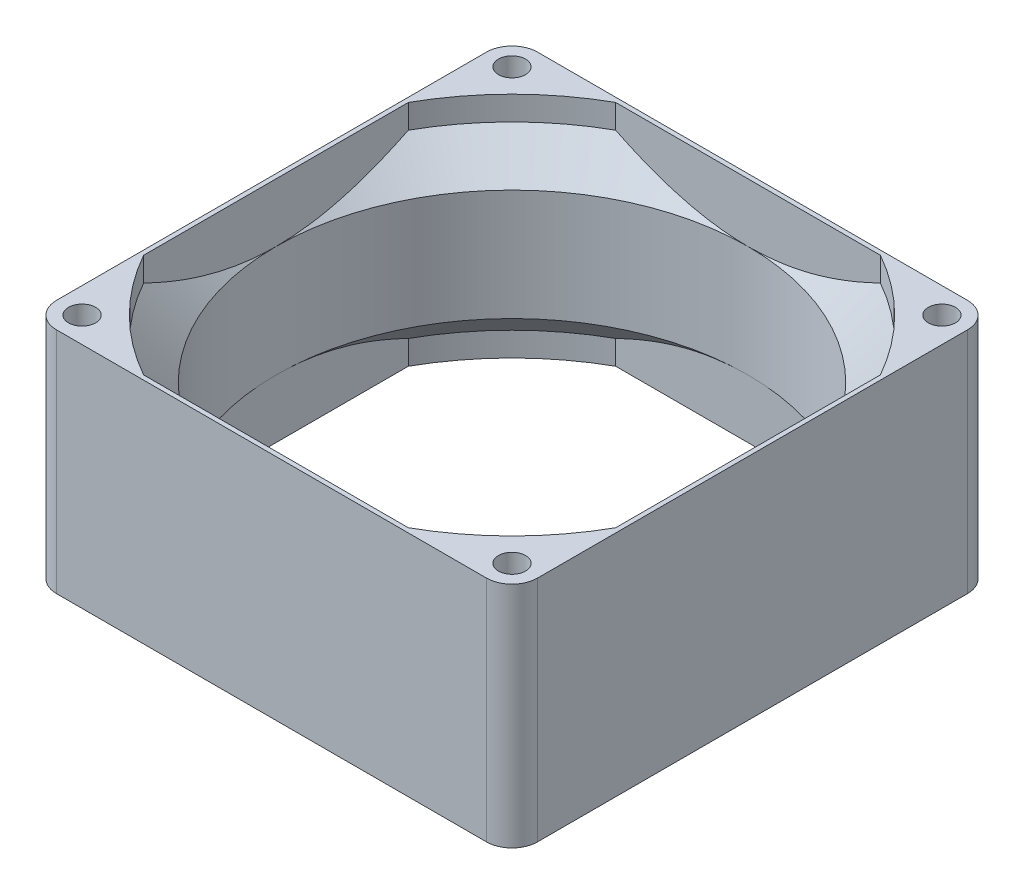
from build123d import *

# Parameters (mm, degrees)
SKETCH1_R               = 2.25
BOSS_EXTRUDE1_DEPTH     = 38
CUT_EXTRUDE1_DEPTH      = 75.121521841
CUT_EXTRUDE1_DEPTH_BACK = 75.121521841


with BuildPart() as part:
    # Sketch1 → Boss-Extrude1 (new body)
    with BuildSketch(Plane(origin=(0, 0, 0), x_dir=(1, 0, 0), z_dir=(0, 1, 0))):
        with BuildLine():
            Line((-35.75, -40), (35.75, -40))
            ThreePointArc((35.75, -40), (38.75520382, -38.75520382), (40, -35.75))
            Line((40, -35.75), (40, 35.75))
            ThreePointArc((40, 35.75), (38.75520382, 38.75520382), (35.75, 40))
            Line((35.75, 40), (-35.75, 40))
            ThreePointArc((-35.75, 40), (-38.75520382, 38.75520382), (-40, 35.75))
            Line((-40, 35.75), (-40, -35.75))
            ThreePointArc((-40, -35.75), (-38.75520382, -38.75520382), (-35.75, -40))
        make_face()
        with Locations((35.75, 35.75)):
            Circle(SKETCH1_R, mode=Mode.SUBTRACT)
        with Locations((35.75, -35.75)):
            Circle(SKETCH1_R, mode=Mode.SUBTRACT)
        with Locations((-35.75, -35.75)):
            Circle(SKETCH1_R, mode=Mode.SUBTRACT)
        with Locations((-35.75, 35.75)):
            Circle(SKETCH1_R, mode=Mode.SUBTRACT)
        with BuildLine():
            Line((22.009940936, 39.25), (-22.009940936, 39.25))
            ThreePointArc((-22.009940936, 39.25), (-31.819805153, 31.819805153), (-39.25, 22.009940936))
            Line((-39.25, 22.009940936), (-39.25, -22.009940936))
            ThreePointArc((-39.25, -22.009940936), (-31.819805153, -31.819805153), (-22.009940936, -39.25))
            Line((-22.009940936, -39.25), (22.009940936, -39.25))
            ThreePointArc((22.009940936, -39.25), (31.819805153, -31.819805153), (39.25, -22.009940936))
            Line((39.25, -22.009940936), (39.25, 22.009940936))
            ThreePointArc((39.25, 22.009940936), (31.819805153, 31.819805153), (22.009940936, 39.25))
        make_face(mode=Mode.SUBTRACT)
    extrude(amount=BOSS_EXTRUDE1_DEPTH)

    # Sketch2 → Revolve1 (revolve)
    with BuildSketch(Plane(origin=(0, 0, 0), x_dir=(0, 0, -1), z_dir=(1, 0, 0))):
        Polygon((45, 34), (39.25, 28.25), (39.25, 9.75), (45, 4), align=None)
    revolve(axis=Axis((0, 0, 0), (0, 1, 0)))

    # Sketch3 → Cut-Extrude1 (cut, two sides: drawn at the far end of the back side and taken through both)
    with BuildSketch(Plane(origin=(0, 0, 0), x_dir=(1, 0, 0), z_dir=(0, 1, 0)).offset(-CUT_EXTRUDE1_DEPTH_BACK)):
        with BuildLine():
            Line((-40, -35.75), (-40, 35.75))
            ThreePointArc((-40, 35.75), (-39.676488013, 37.376404588), (-38.75520382, 38.75520382))
            ThreePointArc((-38.75520382, 38.75520382), (-54.808134855, 0), (-38.75520382, -38.75520382))
            ThreePointArc((-38.75520382, -38.75520382), (-39.676488013, -37.376404588), (-40, -35.75))
        make_face()
        with BuildLine():
            ThreePointArc((38.755203786, 38.755203854), (-2.4e-08, 54.808134855), (-38.75520382, 38.75520382))
            ThreePointArc((-38.75520382, 38.75520382), (-37.376404588, 39.676488013), (-35.75, 40))
            Line((-35.75, 40), (35.75, 40))
            ThreePointArc((35.75, 40), (37.376404566, 39.676488022), (38.755203786, 38.755203854))
        make_face()
        with BuildLine():
            ThreePointArc((-35.75, -40), (-37.376404588, -39.676488013), (-38.75520382, -38.75520382))
            ThreePointArc((-38.75520382, -38.75520382), (6e-09, -54.808134855), (38.755203828, -38.755203812))
            ThreePointArc((38.755203828, -38.755203812), (37.376404593, -39.676488011), (35.75, -40))
            Line((35.75, -40), (-35.75, -40))
        make_face()
        with BuildLine():
            ThreePointArc((38.755203828, -38.755203812), (54.808134855, 2.9e-08), (38.755203786, 38.755203854))
            ThreePointArc((38.755203786, 38.755203854), (39.676488004, 37.376404609), (40, 35.75))
            Line((40, 35.75), (40, -35.75))
            ThreePointArc((40, -35.75), (39.676488015, -37.376404582), (38.755203828, -38.755203812))
        make_face()
    extrude(amount=CUT_EXTRUDE1_DEPTH + CUT_EXTRUDE1_DEPTH_BACK, mode=Mode.SUBTRACT)


solid = part.part
